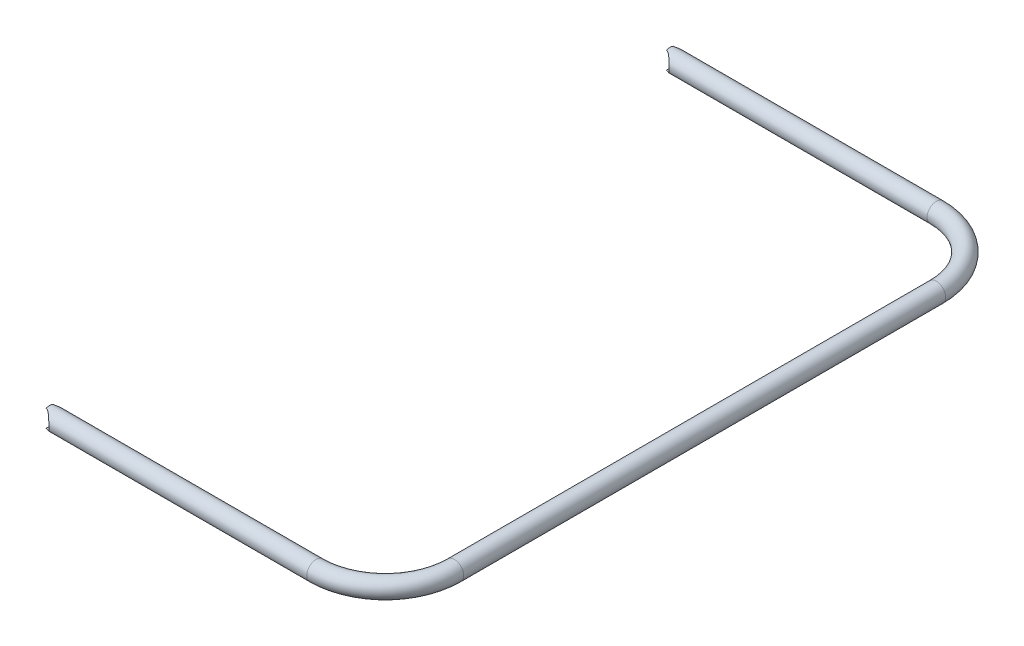
from build123d import *

# Parameters (mm, degrees)
SKETCH_1_R    = 13.5
SKETCH_1_R_2  = 12
OTHER_START   = -9e-09
OTHER_1_DEPTH = 27.000000009


# Read off the part's stored shape, not the designer's step: Полость1
with BuildPart() as part:
    # По траектории1: sweep along a path in Эскиз2
    with BuildLine(Plane(origin=(0, 0, 0), x_dir=(1, 0, 0), z_dir=(0, 1, 0))) as sweep_1_path:
        Line((0, -13.5), (385.446701658, -13.5))
        ThreePointArc((385.446701658, -13.5), (456.157379776, 15.789321881), (485.446701658, 86.5))
        Line((485.446701658, 86.5), (485.446701658, 435))
    # Эскиз1 → По траектории1 (sweep)
    with BuildSketch(Plane(origin=(0, 0, 0), x_dir=(0, 0, -1), z_dir=(1, 0, 0))):
        with Locations((-13.5, 0)):
            Circle(SKETCH_1_R)
        with Locations((-13.5, 0)):
            Circle(SKETCH_1_R_2, mode=Mode.SUBTRACT)
    sweep(path=sweep_1_path.line)

    # Полость1 outline → Полость1 (cut)
    with BuildSketch(Plane.XY.offset(OTHER_START)):
        with BuildLine():
            Line((0, 12.5), (0, -12.5))
            ThreePointArc((0, -12.5), (12.5, 0), (0, 12.5))
        make_face()
    extrude(amount=OTHER_1_DEPTH, mode=Mode.SUBTRACT)

    # Зеркальное отражение1: part across plane


with BuildPart() as part_1:
    add(part.part)
    add(part.part.mirror(Plane(origin=(485.446701658, 0, -435), x_dir=(1, 0, 0), z_dir=(0, 0, -1))))


solid = part_1.part
